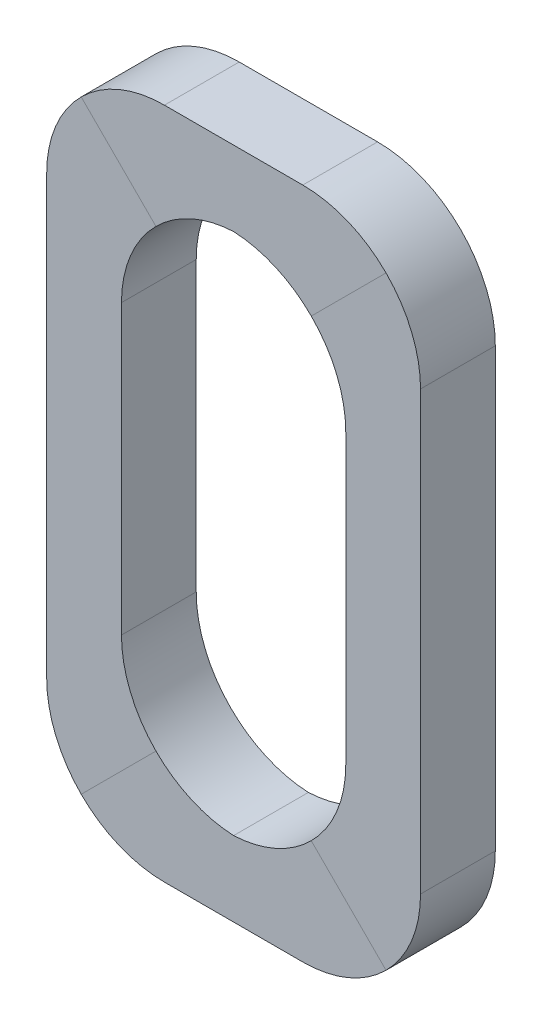
from build123d import *

# Parameters (mm, degrees)
SWEEP1_START       = -3.175
SWEEP1_OUTLINE_W   = 31.75
SWEEP1_OUTLINE_H   = 57.15
SWEEP1_OUTLINE_W_2 = 19.05
SWEEP1_OUTLINE_H_2 = 44.45
SWEEP1_DEPTH       = 6.35
FILLET1_R          = 10
FILLET2_R          = 10


# Read off the part's stored shape, not the designer's step: Sweep1
with BuildPart() as part:
    # Sweep1 outline → Sweep1 (new body)
    with BuildSketch(Plane.XY.offset(SWEEP1_START)):
        with Locations((12.7, 25.4)):
            Rectangle(SWEEP1_OUTLINE_W, SWEEP1_OUTLINE_H)
        with Locations((12.7, 25.4)):
            Rectangle(SWEEP1_OUTLINE_W_2, SWEEP1_OUTLINE_H_2, mode=Mode.SUBTRACT)
    extrude(amount=SWEEP1_DEPTH)

    # Fillet1
    # the kernel refuses this fillet: 10 mm, written as the material it adds along each edge
    with BuildSketch(Plane(origin=(3.175, 3.175, -3.175), x_dir=(1, 0, 0), z_dir=(0, 0, 1)), Plane(origin=(22.225, 3.175, -3.175), x_dir=(0, 1, 0), z_dir=(0, 0, 1)), Plane(origin=(22.225, 47.625, -3.175), x_dir=(-1, 0, 0), z_dir=(0, 0, 1))) as fillet1_piece_1:
        with BuildLine():
            CenterArc((FILLET1_R, FILLET1_R), FILLET1_R, 180, 90)
            Line((0, FILLET1_R), (0, 0))
            Line((0, 0), (FILLET1_R, 0))
        make_face()
    extrude(amount=6.35)
    with BuildSketch(Plane(origin=(3.175, 47.625, -3.175), x_dir=(1, 0, 0), z_dir=(0, 0, 1))) as fillet1_piece_2:
        with BuildLine():
            CenterArc((FILLET1_R, -FILLET1_R), FILLET1_R, 90, 90)
            Line((0, -FILLET1_R), (0, 0))
            Line((0, 0), (FILLET1_R, 0))
        make_face()
    extrude(amount=6.35)

    # Fillet2
    fillet2_edges = [part.edges().sort_by_distance(p)[0] for p in [
        (28.575, -3.175, 0),
        (-3.175, 53.975, 0),
        (-3.175, -3.175, 0),
        (28.575, 53.975, 0),
    ]]
    fillet(fillet2_edges, radius=FILLET2_R)


solid = part.part
